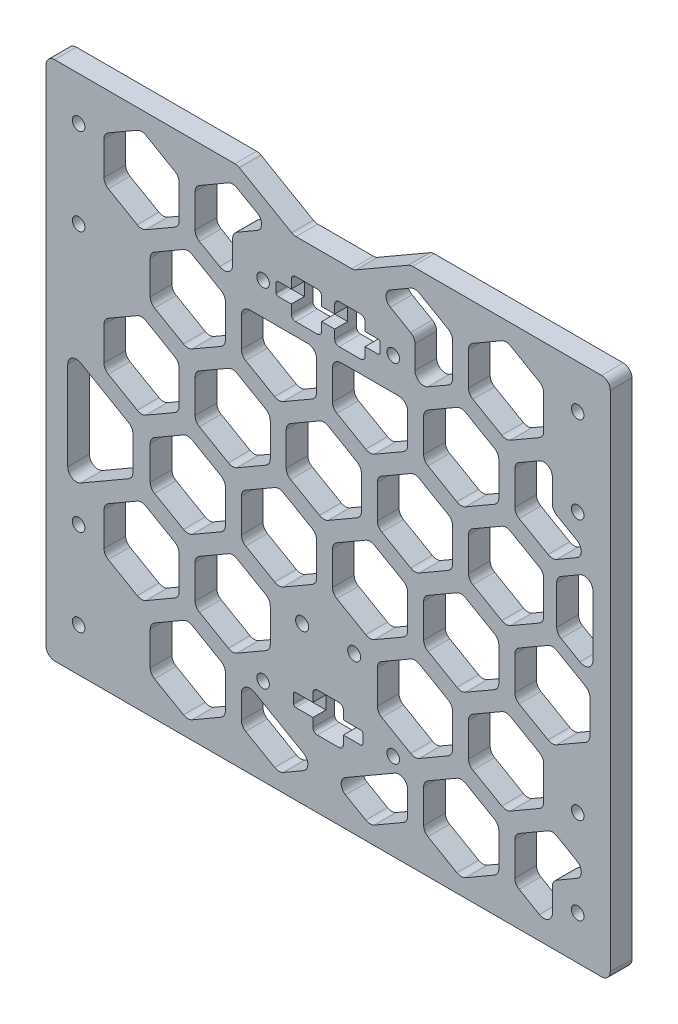
from build123d import *

# Parameters (mm, degrees)
SKETCH_1_W          = 130
SKETCH_1_H          = 120
SKETCH_1_R          = 1.45
EXTRUDE_1_DEPTH     = 5
SKETCH_2_W          = 16
SKETCH_2_H          = 3
SKETCH_2_W_2        = 24
CUT_EXTRUDE_1_DEPTH = 3
SKETCH_3_W          = 7
SKETCH_3_H          = 9
CUT_EXTRUDE_2_DEPTH = 89.600225733
CUT_EXTRUDE_3_DEPTH = 89.600225733
SKETCH_5_R          = 1.5
CUT_EXTRUDE_4_DEPTH = 89.600225733
CUT_EXTRUDE_5_DEPTH = 89.600225733
FILLET_1_R          = 2
FILLET_2_R          = 1
FILLET_3_R          = 0.5
FILLET_4_R          = 2


with BuildPart() as part:
    # 草图1 → 凸台-拉伸1 (new body)
    with BuildSketch(Plane.XY):
        Rectangle(SKETCH_1_W, SKETCH_1_H)
        with Locations((-57.5, -50)):
            Circle(SKETCH_1_R, mode=Mode.SUBTRACT)
        with Locations((-57.5, -30)):
            Circle(SKETCH_1_R, mode=Mode.SUBTRACT)
        with Locations((-57.5, 30)):
            Circle(SKETCH_1_R, mode=Mode.SUBTRACT)
        with Locations((-57.5, 50)):
            Circle(SKETCH_1_R, mode=Mode.SUBTRACT)
        with Locations((57.5, 50)):
            Circle(SKETCH_1_R, mode=Mode.SUBTRACT)
        with Locations((57.5, 30)):
            Circle(SKETCH_1_R, mode=Mode.SUBTRACT)
        with Locations((57.5, -30)):
            Circle(SKETCH_1_R, mode=Mode.SUBTRACT)
        with Locations((57.5, -50)):
            Circle(SKETCH_1_R, mode=Mode.SUBTRACT)
        with Locations((-15, 40)):
            Circle(SKETCH_1_R, mode=Mode.SUBTRACT)
        with Locations((15, 40)):
            Circle(SKETCH_1_R, mode=Mode.SUBTRACT)
        with Locations((-15, -40)):
            Circle(SKETCH_1_R, mode=Mode.SUBTRACT)
        with Locations((15, -40)):
            Circle(SKETCH_1_R, mode=Mode.SUBTRACT)
    extrude(amount=EXTRUDE_1_DEPTH)

    # 草图2 → 切除-拉伸1 (cut)
    with BuildSketch(Plane.XY.offset(5)):
        with Locations((0, -40)):
            Rectangle(SKETCH_2_W, SKETCH_2_H)
        with Locations((0, 40)):
            Rectangle(SKETCH_2_W_2, SKETCH_2_H)
    extrude(amount=-CUT_EXTRUDE_1_DEPTH, mode=Mode.SUBTRACT)

    # 草图3 → 切除-拉伸2 (cut, through all)
    with BuildSketch(Plane.XY.offset(5)):
        with Locations((0, -40)):
            Rectangle(SKETCH_3_W, SKETCH_3_H)
        with Locations((-5, 40)):
            Rectangle(SKETCH_3_W, SKETCH_3_H)
        with Locations((5, 40)):
            Rectangle(SKETCH_3_W, SKETCH_3_H)
    extrude(amount=-CUT_EXTRUDE_2_DEPTH, mode=Mode.SUBTRACT)

    # 草图4 → 切除-拉伸3 (cut, through all)
    with BuildSketch(Plane.XY.offset(5)):
        Polygon((-22, 56), (-30.660254038, 51), (-30.660254038, 41), (-22, 36), (-22, 46), (-13.339745962, 51), align=None)
        Polygon((-43, 56), (-51.660254038, 51), (-51.660254038, 41), (-43, 36), (-34.339745962, 41), (-34.339745962, 51), align=None)
        Polygon((-32.339745962, 37.535898385), (-41, 32.535898385), (-41, 22.535898385), (-32.339745962, 17.535898385), (-23.679491924, 22.535898385), (-23.679491924, 32.535898385), align=None)
        Polygon((-20, 32.535898385), (-20, 22.535898385), (-11.339745962, 17.535898385), (-2.679491924, 22.535898385), (-2.679491924, 32.535898385), align=None)
        Polygon((1, 32.535898385), (1, 22.535898385), (9.660254038, 17.535898385), (18.320508076, 22.535898385), (18.320508076, 32.535898385), align=None)
        Polygon((20, 56), (11.339745962, 51), (20, 46), (20, 36), (28.660254038, 41), (28.660254038, 51), align=None)
        Polygon((30.660254038, 37.535898385), (22, 32.535898385), (22, 22.535898385), (30.660254038, 17.535898385), (39.320508076, 22.535898385), (39.320508076, 32.535898385), align=None)
        Polygon((41, 56), (32.339745962, 51), (32.339745962, 41), (41, 36), (49.660254038, 41), (49.660254038, 51), align=None)
        Polygon((51.660254038, 37.535898385), (43, 32.535898385), (43, 22.535898385), (51.660254038, 17.535898385), (60.320508076, 22.535898385), (51.660254038, 27.535898385), align=None)
        Polygon((-22, 19), (-30.660254038, 14), (-30.660254038, 4), (-22, -1), (-13.339745962, 4), (-13.339745962, 14), align=None)
        Polygon((-11.339745962, 0.535898385), (-20, -4.464101615), (-20, -14.464101615), (-11.339745962, -19.464101615), (-2.679491924, -14.464101615), (-2.679491924, -4.464101615), align=None)
        Polygon((-1, 19), (-9.660254038, 14), (-9.660254038, 4), (-1, -1), (7.660254038, 4), (7.660254038, 14), align=None)
        Polygon((9.660254038, 0.535898385), (1, -4.464101615), (1, -14.464101615), (9.660254038, -19.464101615), (18.320508076, -14.464101615), (18.320508076, -4.464101615), align=None)
        Polygon((20, 19), (11.339745962, 14), (11.339745962, 4), (20, -1), (28.660254038, 4), (28.660254038, 14), align=None)
        Polygon((30.660254038, 0.535898385), (22, -4.464101615), (22, -14.464101615), (30.660254038, -19.464101615), (39.320508076, -14.464101615), (39.320508076, -4.464101615), align=None)
        Polygon((41, 19), (32.339745962, 14), (32.339745962, 4), (41, -1), (49.660254038, 4), (49.660254038, 14), align=None)
        Polygon((51.660254038, 0.535898385), (43, -4.464101615), (43, -14.464101615), (51.660254038, -19.464101615), (60.320508076, -14.464101615), (60.320508076, -4.464101615), align=None)
        Polygon((-22, -18), (-30.660254038, -23), (-30.660254038, -33), (-22, -38), (-13.339745962, -33), (-13.339745962, -23), align=None)
        Polygon((-20, -41.464101615), (-20, -51.464101615), (-11.339745962, -56.464101615), (-2.679491924, -51.464101615), align=None)
        Polygon((1, -51.464101615), (9.660254038, -56.464101615), (18.320508076, -51.464101615), (18.320508076, -41.464101615), align=None)
        Polygon((20, -18), (11.339745962, -23), (11.339745962, -33), (20, -38), (28.660254038, -33), (28.660254038, -23), align=None)
        Polygon((30.660254038, -36.464101615), (22, -41.464101615), (22, -51.464101615), (30.660254038, -56.464101615), (39.320508076, -51.464101615), (39.320508076, -41.464101615), align=None)
        Polygon((41, -18), (32.339745962, -23), (32.339745962, -33), (41, -38), (49.660254038, -33), (49.660254038, -23), align=None)
        Polygon((51.660254038, -36.464101615), (43, -41.464101615), (43, -51.464101615), (51.660254038, -56.464101615), (51.660254038, -46.464101615), (60.320508076, -41.464101615), align=None)
        Polygon((-43, 19), (-51.660254038, 14), (-51.660254038, 4), (-43, -1), (-34.339745962, 4), (-34.339745962, 14), align=None)
        Polygon((-32.339745962, 0.535898385), (-41, -4.464101615), (-41, -14.464101615), (-32.339745962, -19.464101615), (-23.679491924, -14.464101615), (-23.679491924, -4.464101615), align=None)
        Polygon((-43, -18), (-51.660254038, -23), (-51.660254038, -33), (-43, -38), (-34.339745962, -33), (-34.339745962, -23), align=None)
        Polygon((-32.339745962, -36.464101615), (-41, -41.464101615), (-41, -51.464101615), (-32.339745962, -56.464101615), (-23.679491924, -51.464101615), (-23.679491924, -41.464101615), align=None)
    extrude(amount=-CUT_EXTRUDE_3_DEPTH, mode=Mode.SUBTRACT)

    # 草图5 → 切除-拉伸4 (cut, through all)
    with BuildSketch(Plane.XY.offset(5)):
        with Locations((-6, -24)):
            Circle(SKETCH_5_R)
        with Locations((6, -24)):
            Circle(SKETCH_5_R)
        Polygon((-20.92820323, 60), (-7.937822174, 52.5), (5.937822174, 52.5), (18.92820323, 60), align=None)
    extrude(amount=-CUT_EXTRUDE_4_DEPTH, mode=Mode.SUBTRACT)

    # 草图6 → 切除-拉伸5 (cut, through all)
    with BuildSketch(Plane.XY.offset(5)):
        Polygon((-60, 4.196152423), (-45, -4.464101615), (-45, -14.535898385), (-60, -23.196152423), align=None)
        Polygon((61, 19.464101615), (52.660254038, 14.649147039), (52.660254038, 3.422649731), (61, -1.392304845), align=None)
    extrude(amount=-CUT_EXTRUDE_5_DEPTH, mode=Mode.SUBTRACT)

    # 圆角1
    fillet_1_edges = [part.edges().sort_by_distance(p)[0] for p in [
        (51.660254038, -56.464101615, 2.5),
        (43, -51.464101615, 2.5),
        (43, -41.464101615, 2.5),
        (51.660254038, -36.464101615, 2.5),
        (60.320508076, -41.464101615, 2.5),
        (51.660254038, -46.464101615, 2.5),
        (60.320508076, 22.535898385, 2.5),
        (51.660254038, 17.535898385, 2.5),
        (43, 22.535898385, 2.5),
        (43, 32.535898385, 2.5),
        (51.660254038, 37.535898385, 2.5),
        (51.660254038, 27.535898385, 2.5),
        (-22, 36, 2.5),
        (-30.660254038, 41, 2.5),
        (-30.660254038, 51, 2.5),
        (-22, 56, 2.5),
        (-13.339745962, 51, 2.5),
        (-22, 46, 2.5),
        (-34.339745962, 51, 2.5),
        (-34.339745962, 41, 2.5),
        (-43, 36, 2.5),
        (-51.660254038, 41, 2.5),
        (-51.660254038, 51, 2.5),
        (-43, 56, 2.5),
        (-20, -41.464101615, 2.5),
        (-2.679491924, -51.464101615, 2.5),
        (-11.339745962, -56.464101615, 2.5),
        (-20, -51.464101615, 2.5),
        (1, -51.464101615, 2.5),
        (18.320508076, -41.464101615, 2.5),
        (18.320508076, -51.464101615, 2.5),
        (9.660254038, -56.464101615, 2.5),
        (11.339745962, 51, 2.5),
        (20, 56, 2.5),
        (28.660254038, 51, 2.5),
        (28.660254038, 41, 2.5),
        (20, 36, 2.5),
        (20, 46, 2.5),
        (-20, 32.535898385, 2.5),
        (-2.679491924, 32.535898385, 2.5),
        (-2.679491924, 22.535898385, 2.5),
        (-11.339745962, 17.535898385, 2.5),
        (-20, 22.535898385, 2.5),
        (18.320508076, -4.464101615, 2.5),
        (18.320508076, -14.464101615, 2.5),
        (9.660254038, -19.464101615, 2.5),
        (1, -14.464101615, 2.5),
        (1, -4.464101615, 2.5),
        (9.660254038, 0.535898385, 2.5),
        (28.660254038, 14, 2.5),
        (28.660254038, 4, 2.5),
        (20, -1, 2.5),
        (11.339745962, 4, 2.5),
        (11.339745962, 14, 2.5),
        (20, 19, 2.5),
        (7.660254038, 14, 2.5),
        (7.660254038, 4, 2.5),
        (-1, -1, 2.5),
        (-9.660254038, 4, 2.5),
        (-9.660254038, 14, 2.5),
        (-1, 19, 2.5),
        (1, 32.535898385, 2.5),
        (18.320508076, 32.535898385, 2.5),
        (18.320508076, 22.535898385, 2.5),
        (9.660254038, 17.535898385, 2.5),
        (1, 22.535898385, 2.5),
        (49.660254038, 14, 2.5),
        (49.660254038, 4, 2.5),
        (41, -1, 2.5),
        (32.339745962, 4, 2.5),
        (32.339745962, 14, 2.5),
        (41, 19, 2.5),
        (60.320508076, -4.464101615, 2.5),
        (60.320508076, -14.464101615, 2.5),
        (51.660254038, -19.464101615, 2.5),
        (43, -14.464101615, 2.5),
        (43, -4.464101615, 2.5),
        (51.660254038, 0.535898385, 2.5),
        (49.660254038, 51, 2.5),
        (49.660254038, 41, 2.5),
        (41, 36, 2.5),
        (32.339745962, 41, 2.5),
        (32.339745962, 51, 2.5),
        (41, 56, 2.5),
        (39.320508076, 32.535898385, 2.5),
        (39.320508076, 22.535898385, 2.5),
        (30.660254038, 17.535898385, 2.5),
        (22, 22.535898385, 2.5),
        (22, 32.535898385, 2.5),
        (30.660254038, 37.535898385, 2.5),
        (39.320508076, -41.464101615, 2.5),
        (39.320508076, -51.464101615, 2.5),
        (30.660254038, -56.464101615, 2.5),
        (22, -51.464101615, 2.5),
        (22, -41.464101615, 2.5),
        (30.660254038, -36.464101615, 2.5),
        (28.660254038, -23, 2.5),
        (28.660254038, -33, 2.5),
        (20, -38, 2.5),
        (11.339745962, -33, 2.5),
        (11.339745962, -23, 2.5),
        (20, -18, 2.5),
        (39.320508076, -4.464101615, 2.5),
        (39.320508076, -14.464101615, 2.5),
        (30.660254038, -19.464101615, 2.5),
        (22, -14.464101615, 2.5),
        (22, -4.464101615, 2.5),
        (30.660254038, 0.535898385, 2.5),
        (49.660254038, -23, 2.5),
        (49.660254038, -33, 2.5),
        (41, -38, 2.5),
        (32.339745962, -33, 2.5),
        (32.339745962, -23, 2.5),
        (41, -18, 2.5),
        (-23.679491924, -4.464101615, 2.5),
        (-23.679491924, -14.464101615, 2.5),
        (-32.339745962, -19.464101615, 2.5),
        (-41, -14.464101615, 2.5),
        (-41, -4.464101615, 2.5),
        (-32.339745962, 0.535898385, 2.5),
        (-34.339745962, -23, 2.5),
        (-34.339745962, -33, 2.5),
        (-43, -38, 2.5),
        (-51.660254038, -33, 2.5),
        (-51.660254038, -23, 2.5),
        (-43, -18, 2.5),
        (-23.679491924, 32.535898385, 2.5),
        (-23.679491924, 22.535898385, 2.5),
        (-32.339745962, 17.535898385, 2.5),
        (-41, 22.535898385, 2.5),
        (-41, 32.535898385, 2.5),
        (-32.339745962, 37.535898385, 2.5),
        (-34.339745962, 14, 2.5),
        (-34.339745962, 4, 2.5),
        (-43, -1, 2.5),
        (-51.660254038, 4, 2.5),
        (-51.660254038, 14, 2.5),
        (-43, 19, 2.5),
        (-2.679491924, -4.464101615, 2.5),
        (-2.679491924, -14.464101615, 2.5),
        (-11.339745962, -19.464101615, 2.5),
        (-20, -14.464101615, 2.5),
        (-20, -4.464101615, 2.5),
        (-11.339745962, 0.535898385, 2.5),
        (-13.339745962, 14, 2.5),
        (-13.339745962, 4, 2.5),
        (-22, -1, 2.5),
        (-30.660254038, 4, 2.5),
        (-30.660254038, 14, 2.5),
        (-22, 19, 2.5),
        (-23.679491924, -41.464101615, 2.5),
        (-23.679491924, -51.464101615, 2.5),
        (-32.339745962, -56.464101615, 2.5),
        (-41, -51.464101615, 2.5),
        (-41, -41.464101615, 2.5),
        (-32.339745962, -36.464101615, 2.5),
        (-13.339745962, -23, 2.5),
        (-13.339745962, -33, 2.5),
        (-22, -38, 2.5),
        (-30.660254038, -33, 2.5),
        (-30.660254038, -23, 2.5),
        (-22, -18, 2.5),
        (61, -1.392304845, 2.5),
        (52.660254038, 3.422649731, 2.5),
        (52.660254038, 14.649147039, 2.5),
        (61, 19.464101615, 2.5),
        (-60, 4.196152423, 2.5),
        (-45, -14.535898385, 2.5),
        (-60, -23.196152423, 2.5),
        (-45, -4.464101615, 2.5),
    ]]
    fillet(fillet_1_edges, radius=FILLET_1_R)

    # 圆角2
    fillet_2_edges = [part.edges().sort_by_distance(p)[0] for p in [
        (3.5, -44.5, 2.5),
        (-3.5, -44.5, 2.5),
        (3.5, -35.5, 2.5),
        (-3.5, -35.5, 2.5),
        (8.5, 35.5, 2.5),
        (1.5, 35.5, 2.5),
        (8.5, 44.5, 2.5),
        (1.5, 44.5, 2.5),
        (-1.5, 35.5, 2.5),
        (-8.5, 35.5, 2.5),
        (-1.5, 44.5, 2.5),
        (-8.5, 44.5, 2.5),
    ]]
    fillet(fillet_2_edges, radius=FILLET_2_R)

    # 圆角3
    fillet_3_edges = [part.edges().sort_by_distance(p)[0] for p in [
        (12, 38.5, 3.5),
        (12, 41.5, 3.5),
        (-12, 38.5, 3.5),
        (-12, 41.5, 3.5),
        (8, -41.5, 3.5),
        (8, -38.5, 3.5),
        (-8, -41.5, 3.5),
        (-8, -38.5, 3.5),
    ]]
    fillet(fillet_3_edges, radius=FILLET_3_R)

    # 圆角4
    fillet_4_edges = [part.edges().sort_by_distance(p)[0] for p in [
        (65, 60, 2.5),
        (65, -60, 2.5),
        (-65, -60, 2.5),
        (-20.92820323, 60, 2.5),
        (-7.937822174, 52.5, 2.5),
        (5.937822174, 52.5, 2.5),
        (18.92820323, 60, 2.5),
        (-65, 60, 2.5),
    ]]
    fillet(fillet_4_edges, radius=FILLET_4_R)


solid = part.part
